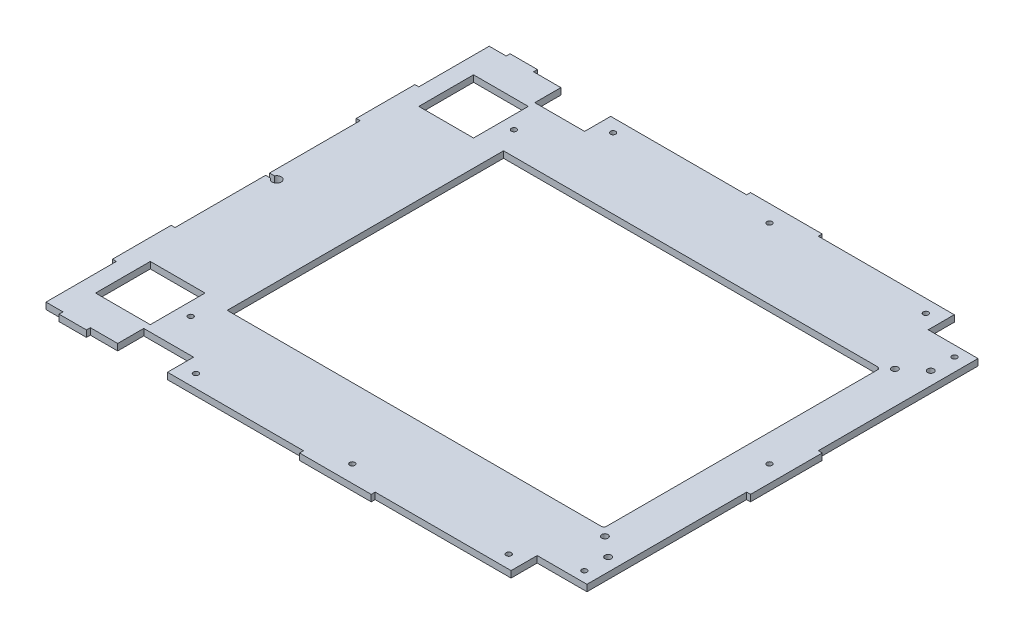
from build123d import *

# Parameters (mm, degrees)
SKETCH1_3_R              = 2
SKETCH1_3_R_2            = 2.425
SKETCH1_3_R_3            = 1.5
BOSS_EXTRUDE2_DEPTH      = 5
SCHIZZO2_W               = 42
SCHIZZO2_H               = 42
TAGLIO_ESTRUSIONE2_DEPTH = 287.248144099
TAGLIO_ESTRUSIONE3_REACH = 288.248
SKETCH1_10_W             = 38.2
SKETCH1_10_H             = 20
SKETCH1_10_R             = 2


with BuildPart() as part:
    # Sketch1<3> → Boss-Extrude2 (new body)
    with BuildSketch(Plane(origin=(0, 0, 0), x_dir=(1, 0, 0), z_dir=(0, 1, 0))):
        with BuildLine():
            Line((170, 27.5), (170, 170))
            Line((170, 170), (27.5, 170))
            Line((27.5, 170), (27.5, 173))
            Line((27.5, 173), (-27.5, 173))
            Line((-27.5, 173), (-27.5, 170))
            Line((-27.5, 170), (-191, 170))
            Line((-191, 170), (-191, 173))
            Line((-191, 173), (-212, 173))
            Line((-212, 173), (-212, 170))
            Line((-212, 170), (-225, 170))
            Line((-225, 170), (-225, 116))
            Line((-225, 116), (-228, 116))
            Line((-228, 116), (-228, 71))
            Line((-228, 71), (-225, 71))
            Line((-225, 71), (-225, 1.5))
            Line((-225, 1.5), (-221.16227766, 1.5))
            ThreePointArc((-221.16227766, 1.5), (-214.5, 0), (-221.16227766, -1.5))
            Line((-221.16227766, -1.5), (-225, -1.5))
            Line((-225, -1.5), (-225, -71))
            Line((-225, -71), (-228, -71))
            Line((-228, -71), (-228, -116))
            Line((-228, -116), (-225, -116))
            Line((-225, -116), (-225, -170))
            Line((-225, -170), (-212, -170))
            Line((-212, -170), (-212, -173))
            Line((-212, -173), (-191, -173))
            Line((-191, -173), (-191, -170))
            Line((-191, -170), (-27.5, -170))
            Line((-27.5, -170), (-27.5, -173))
            Line((-27.5, -173), (27.5, -173))
            Line((27.5, -173), (27.5, -170))
            Line((27.5, -170), (170, -170))
            Line((170, -170), (170, -27.5))
            Line((170, -27.5), (173, -27.5))
            Line((173, -27.5), (173, 27.5))
            Line((173, 27.5), (170, 27.5))
        make_face()
        with BuildLine():
            Line((139, 104), (139, -104))
            ThreePointArc((139, -104), (138.414213562, -105.414213562), (137, -106))
            Line((137, -106), (-150, -106))
            Line((-150, -106), (-150, 106))
            Line((-150, 106), (137, 106))
            ThreePointArc((137, 106), (138.414213562, 105.414213562), (139, 104))
        make_face(mode=Mode.SUBTRACT)
        with Locations((160, -142)):
            Circle(SKETCH1_3_R, mode=Mode.SUBTRACT)
        with Locations((145, -111.25)):
            Circle(SKETCH1_3_R_2, mode=Mode.SUBTRACT)
        with Locations((160, -123.75)):
            Circle(SKETCH1_3_R_2, mode=Mode.SUBTRACT)
        with Locations((160, 0)):
            Circle(SKETCH1_3_R, mode=Mode.SUBTRACT)
        with Locations((145, 111.25)):
            Circle(SKETCH1_3_R_2, mode=Mode.SUBTRACT)
        with Locations((160, 123.75)):
            Circle(SKETCH1_3_R_2, mode=Mode.SUBTRACT)
        with Locations((160, 142)):
            Circle(SKETCH1_3_R, mode=Mode.SUBTRACT)
        with Locations((-160, 124)):
            Circle(SKETCH1_3_R, mode=Mode.SUBTRACT)
        with Locations((0, -160)):
            Circle(SKETCH1_3_R, mode=Mode.SUBTRACT)
        with Locations((120, -160)):
            Circle(SKETCH1_3_R, mode=Mode.SUBTRACT)
        with Locations((-120, -160)):
            Circle(SKETCH1_3_R, mode=Mode.SUBTRACT)
        with Locations((120, 160)):
            Circle(SKETCH1_3_R, mode=Mode.SUBTRACT)
        with Locations((0, 160)):
            Circle(SKETCH1_3_R, mode=Mode.SUBTRACT)
        with Locations((-120, 160)):
            Circle(SKETCH1_3_R, mode=Mode.SUBTRACT)
        with Locations((-206.5, -108.5)):
            Circle(SKETCH1_3_R_3, mode=Mode.SUBTRACT)
        with Locations((-175.5, -108.5)):
            Circle(SKETCH1_3_R_3, mode=Mode.SUBTRACT)
        with Locations((-206.5, -139.5)):
            Circle(SKETCH1_3_R_3, mode=Mode.SUBTRACT)
        with Locations((-175.5, -139.5)):
            Circle(SKETCH1_3_R_3, mode=Mode.SUBTRACT)
        with Locations((-206.5, 139.5)):
            Circle(SKETCH1_3_R_3, mode=Mode.SUBTRACT)
        with Locations((-175.5, 139.5)):
            Circle(SKETCH1_3_R_3, mode=Mode.SUBTRACT)
        with Locations((-206.5, 108.5)):
            Circle(SKETCH1_3_R_3, mode=Mode.SUBTRACT)
        with Locations((-175.5, 108.5)):
            Circle(SKETCH1_3_R_3, mode=Mode.SUBTRACT)
    extrude(amount=BOSS_EXTRUDE2_DEPTH)

    # Schizzo2 → Taglio-Estrusione2 (cut, through all)
    with BuildSketch(Plane(origin=(0, 5, 0), x_dir=(1, 0, 0), z_dir=(0, 1, 0))):
        with Locations((-191, 124)):
            Rectangle(SCHIZZO2_W, SCHIZZO2_H)
    taglio_estrusione2 = extrude(amount=-TAGLIO_ESTRUSIONE2_DEPTH, mode=Mode.SUBTRACT)

    # Specchia1: Taglio-Estrusione2 across plane
    add(taglio_estrusione2.mirror(Plane.XY), mode=Mode.SUBTRACT)

    # Sketch1<10> → Taglio-Estrusione3 (cut, up to next)
    with BuildSketch(Plane(origin=(0, 0, 0), x_dir=(1, 0, 0), z_dir=(0, 1, 0)), mode=Mode.PRIVATE) as taglio_estrusione3_sk1:
        with Locations((150.9, -160)):
            Rectangle(SKETCH1_10_W, SKETCH1_10_H)
    taglio_estrusione3_tool1 = extrude(taglio_estrusione3_sk1.sketch, amount=TAGLIO_ESTRUSIONE3_REACH, mode=Mode.PRIVATE) & part.part
    # Sketch1<10> → Taglio-Estrusione3 (cut, up to next)
    with BuildSketch(Plane(origin=(0, 0, 0), x_dir=(1, 0, 0), z_dir=(0, 1, 0)), mode=Mode.PRIVATE) as taglio_estrusione3_sk2:
        with Locations((150.9, 160)):
            Rectangle(SKETCH1_10_W, SKETCH1_10_H)
    taglio_estrusione3_tool2 = extrude(taglio_estrusione3_sk2.sketch, amount=TAGLIO_ESTRUSIONE3_REACH, mode=Mode.PRIVATE) & part.part
    # Sketch1<10> → Taglio-Estrusione3 (cut, up to next)
    with BuildSketch(Plane(origin=(0, 0, 0), x_dir=(1, 0, 0), z_dir=(0, 1, 0)), mode=Mode.PRIVATE) as taglio_estrusione3_sk3:
        with Locations((-150.9, -160)):
            Rectangle(SKETCH1_10_W, SKETCH1_10_H)
    taglio_estrusione3_tool3 = extrude(taglio_estrusione3_sk3.sketch, amount=TAGLIO_ESTRUSIONE3_REACH, mode=Mode.PRIVATE) & part.part
    # Sketch1<10> → Taglio-Estrusione3 (cut, up to next)
    with BuildSketch(Plane(origin=(0, 0, 0), x_dir=(1, 0, 0), z_dir=(0, 1, 0)), mode=Mode.PRIVATE) as taglio_estrusione3_sk4:
        with Locations((-160, -124)):
            Circle(SKETCH1_10_R)
    taglio_estrusione3_tool4 = extrude(taglio_estrusione3_sk4.sketch, amount=TAGLIO_ESTRUSIONE3_REACH, mode=Mode.PRIVATE) & part.part
    # Sketch1<10> → Taglio-Estrusione3 (cut, up to next)
    with BuildSketch(Plane(origin=(0, 0, 0), x_dir=(1, 0, 0), z_dir=(0, 1, 0)), mode=Mode.PRIVATE) as taglio_estrusione3_sk5:
        Polygon((-161, 150), (-131.8, 150), (-131.8, 170), (-170, 170), (-170, 150), align=None)
    taglio_estrusione3_tool5 = extrude(taglio_estrusione3_sk5.sketch, amount=TAGLIO_ESTRUSIONE3_REACH, mode=Mode.PRIVATE) & part.part
    add(taglio_estrusione3_tool1.solids().sort_by_distance((150.9, 0, 160))[0], mode=Mode.SUBTRACT)
    add(taglio_estrusione3_tool2.solids().sort_by_distance((150.9, 0, -160))[0], mode=Mode.SUBTRACT)
    add(taglio_estrusione3_tool3.solids().sort_by_distance((-150.9, 0, 160))[0], mode=Mode.SUBTRACT)
    add(taglio_estrusione3_tool4.solids().sort_by_distance((-160, 0, 124))[0], mode=Mode.SUBTRACT)
    add(taglio_estrusione3_tool5.solids().sort_by_distance((-150.9, 0, -160))[0], mode=Mode.SUBTRACT)


solid = part.part
